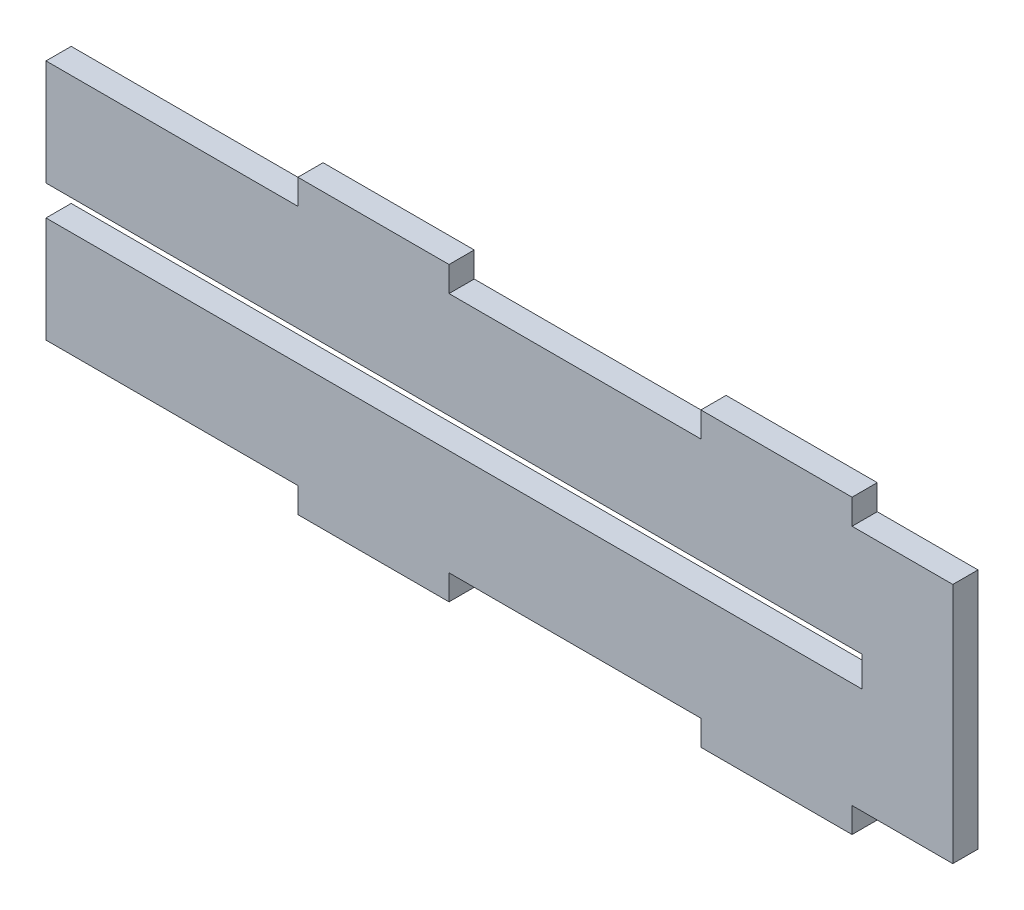
from build123d import *

# Parameters (mm, degrees)
RESSALTO_EXTRUS_O1_DEPTH = 5


with BuildPart() as part:
    # Esboço1 → Ressalto-extrusão1 (new body)
    with BuildSketch(Plane.XY):
        Polygon((0, -27), (0, -48), (50, -48), (50, -53), (80, -53), (80, -48), (130, -48), (130, -53), (160, -53), (160, -48), (180, -48), (180, 0), (160, 0), (160, 5), (130, 5), (130, 0), (80, 0), (80, 5), (50, 5), (50, 0), (0, 0), (0, -21), (162, -21), (162, -27), align=None)
    extrude(amount=RESSALTO_EXTRUS_O1_DEPTH)


solid = part.part
